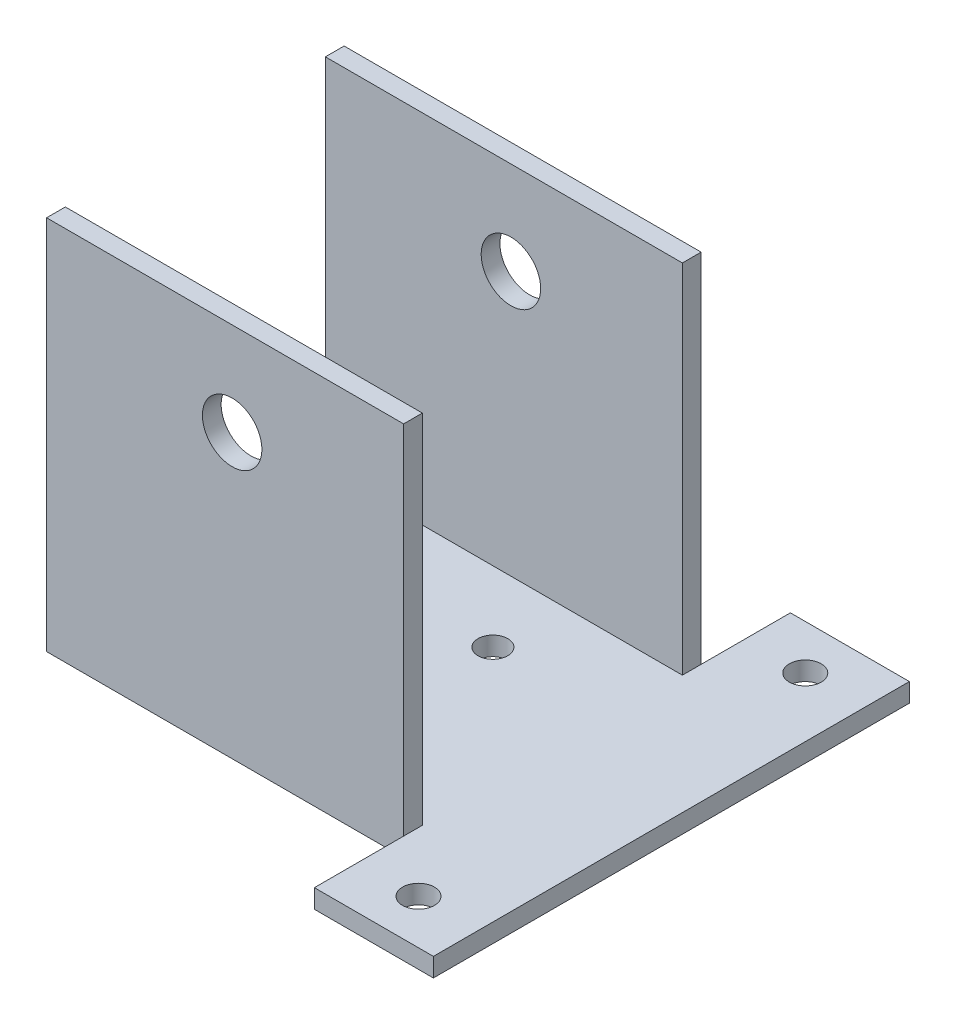
from build123d import *

# Parameters (mm, degrees)
SKETCH1_R           = 1.7
SKETCH1_R_2         = 1.5875
BOSS_EXTRUDE1_DEPTH = 2
SKETCH2_W           = 38.1
SKETCH2_H           = 2
BOSS_EXTRUDE2_DEPTH = 38.1
SKETCH3_R           = 3.175
CUT_EXTRUDE1_DEPTH  = 63.903065307


with BuildPart() as part:
    # Sketch1 → Boss-Extrude1 (new body)
    with BuildSketch(Plane(origin=(0, 0, 0), x_dir=(1, 0, 0), z_dir=(0, 1, 0))):
        Polygon((-25.4, 15.875), (12.7, 15.875), (12.7, 25.4), (25.4, 25.4), (25.4, -25.4), (12.7, -25.4), (12.7, -15.875), (-25.4, -15.875), align=None)
        with Locations((19.05, 20.6375)):
            Circle(SKETCH1_R, mode=Mode.SUBTRACT)
        with Locations((19.05, -20.6375)):
            Circle(SKETCH1_R, mode=Mode.SUBTRACT)
        with Locations((0, 6.35)):
            Circle(SKETCH1_R_2, mode=Mode.SUBTRACT)
        with Locations((0, -6.35)):
            Circle(SKETCH1_R_2, mode=Mode.SUBTRACT)
    extrude(amount=BOSS_EXTRUDE1_DEPTH)

    # Sketch2 → Boss-Extrude2 (add)
    with BuildSketch(Plane(origin=(0, 2, 0), x_dir=(1, 0, 0), z_dir=(0, 1, 0))):
        with Locations((-6.35, 14.875)):
            Rectangle(SKETCH2_W, SKETCH2_H)
        with Locations((-6.35, -14.875)):
            Rectangle(SKETCH2_W, SKETCH2_H)
    extrude(amount=BOSS_EXTRUDE2_DEPTH)

    # Sketch3 → Cut-Extrude1 (cut, through all)
    with BuildSketch(Plane.XY.offset(15.875)):
        with Locations((-5.6, 30.16795818)):
            Circle(SKETCH3_R)
    extrude(amount=-CUT_EXTRUDE1_DEPTH, mode=Mode.SUBTRACT)


solid = part.part
